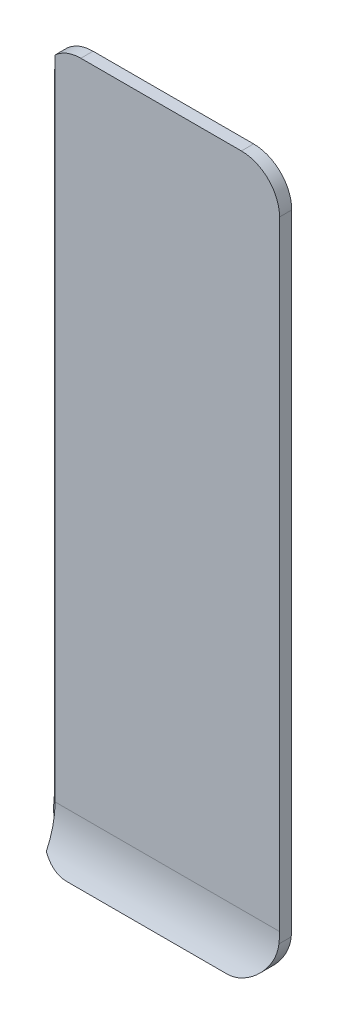
from build123d import *

# Parameters (mm, degrees)
BOSS_EXTRUDE1_DEPTH = 70
CUT_EXTRUDE1_DEPTH  = 1953.700949966
CUT_EXTRUDE2_DEPTH  = 32.5


with BuildPart() as part:
    # Sketch1 → Boss-Extrude1 (new body)
    with BuildSketch(Plane.XY):
        with BuildLine():
            Line((100, 0), (521, 0))
            ThreePointArc((521, 0), (591.710678119, 29.289321881), (621, 100))
            Line((621, 100), (621, 1750))
            ThreePointArc((621, 1750), (591.710678119, 1820.710678119), (521, 1850))
            Line((521, 1850), (100, 1850))
            ThreePointArc((100, 1850), (29.289321881, 1820.710678119), (0, 1750))
            Line((0, 1750), (0, 100))
            ThreePointArc((0, 100), (29.289321881, 29.289321881), (100, 0))
        make_face()
    extrude(amount=BOSS_EXTRUDE1_DEPTH)

    # Sketch2 → Cut-Extrude1 (cut, through all)
    with BuildSketch(Plane.ZY):
        with BuildLine():
            Line((70, 1850), (32, 1850))
            Line((32, 1850), (32, 127.446930132))
            ThreePointArc((32, 127.446930132), (41.702246447, 60.951215984), (70, 0))
            Line((70, 0), (70, 1850))
        make_face()
        with BuildLine():
            Line((0, 127.446930132), (0, 0))
            Line((0, 0), (32.698538924, 0))
            ThreePointArc((32.698538924, 0), (8.304907254, 61.659555872), (0, 127.446930132))
        make_face()
    extrude(amount=-CUT_EXTRUDE1_DEPTH, mode=Mode.SUBTRACT)

    # Sketch4 → Cut-Extrude2 (cut)
    with BuildSketch(Plane.ZY):
        with BuildLine():
            Line((1, 1850), (32, 1850))
            Line((32, 1850), (32, 127.446930132))
            ThreePointArc((32, 127.446930132), (41.702246447, 60.951215984), (70, 0))
            Line((70, 0), (33.840121275, 0))
            ThreePointArc((33.840121275, 0), (9.341966472, 61.641927348), (1, 127.446930132))
            Line((1, 127.446930132), (1, 1850))
        make_face()
    extrude(amount=-CUT_EXTRUDE2_DEPTH, mode=Mode.SUBTRACT)


solid = part.part
